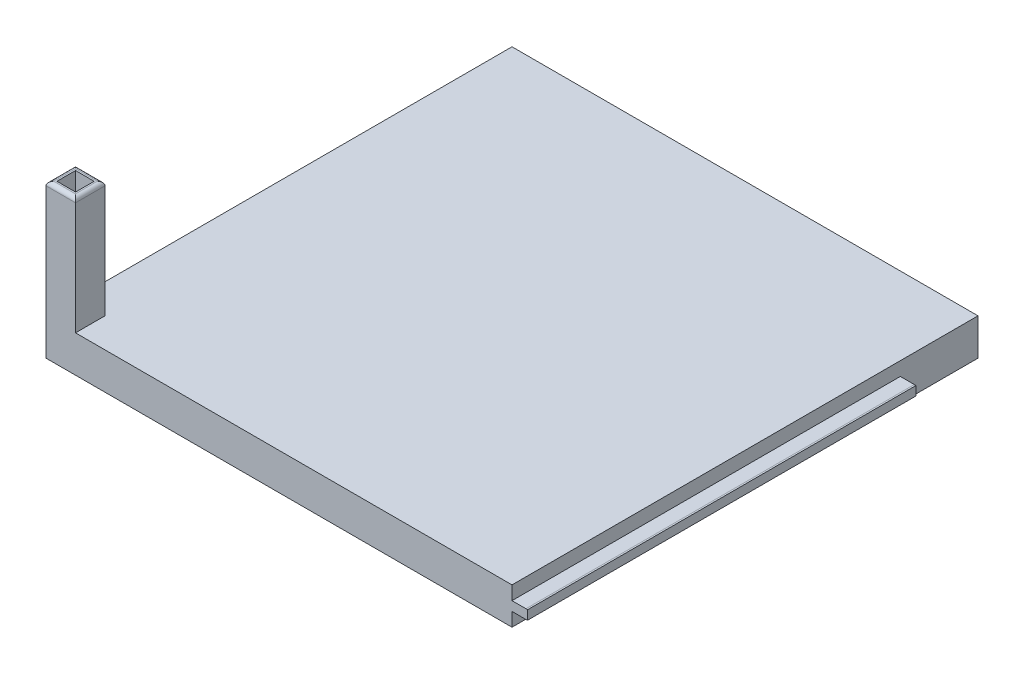
from build123d import *

# Parameters (mm, degrees)
SKETCH1_W                 = 152.4
SKETCH1_H                 = 152.4
BOSS_EXTRUDE2_DEPTH       = 12
SKETCH2_W                 = 9.652
SKETCH2_H                 = 9.652
BOSS_EXTRUDE3_DEPTH       = 38.1
SKETCH3_W                 = 5.08
SKETCH3_H                 = 3.048
BOSS_EXTRUDE4_DEPTH       = 127
CHAMFER1_SIZE             = 0.508
CHAMFER1_SIZE2            = 0.03552282
CHAMFER2_SIZE             = 0.508
CHAMFER2_SIZE2            = 0.03552282
SKETCH4_W                 = 5.334
SKETCH4_H                 = 3.175
CUT_EXTRUDE3_DEPTH        = 149.86
SKETCH5_R                 = 4.445
BOSS_EXTRUDE5_DEPTH       = 15
F_2_0MM_DOWEL_HOLE1_D     = 2
F_2_0MM_DOWEL_HOLE1_DEPTH = 4.572
F_2_0MM_DOWEL_HOLE1_TIP   = 0.600860619
SHELL1_START              = 1.778
SHELL1_OUTLINE_W          = 148.844
SHELL1_OUTLINE_H          = 143.51
SHELL1_DEPTH              = 8.444
SHELL1_START_2            = 10.222
SHELL1_2_OUTLINE_W        = 6.096
SHELL1_2_OUTLINE_H        = 6.096
SHELL1_2_DEPTH            = 39.878
SHELL1_3_OUTLINE_W        = 148.844
SHELL1_3_OUTLINE_H        = 5.334
SHELL1_3_DEPTH            = 0.8565
SHELL1_START_3            = 9.3655
SHELL1_4_OUTLINE_W        = 148.844
SHELL1_4_OUTLINE_H        = 5.334
SHELL1_4_DEPTH            = 0.8565
SHELL1_START_4            = -7.752865101
SHELL1_5_OUTLINE_R        = 2.667
SHELL1_5_DEPTH            = 9.530865101
FILLET1_R                 = 1.27


with BuildPart() as part:
    # Sketch1 → Boss-Extrude2 (new body)
    with BuildSketch(Plane(origin=(0, 0, 0), x_dir=(1, 0, 0), z_dir=(0, 1, 0))):
        with Locations((53.878787879, -60.325)):
            Rectangle(SKETCH1_W, SKETCH1_H)
    extrude(amount=BOSS_EXTRUDE2_DEPTH)

    # Sketch2 → Boss-Extrude3 (add)
    with BuildSketch(Plane(origin=(0, 12, 0), x_dir=(1, 0, 0), z_dir=(0, 1, 0))):
        with Locations((-17.495212121, -131.699)):
            Rectangle(SKETCH2_W, SKETCH2_H)
    extrude(amount=BOSS_EXTRUDE3_DEPTH)

    # Sketch3 → Boss-Extrude4 (add)
    with BuildSketch(Plane.XY.offset(136.525)):
        with Locations((132.618787879, 6)):
            Rectangle(SKETCH3_W, SKETCH3_H)
    extrude(amount=-BOSS_EXTRUDE4_DEPTH)

    # Chamfer1
    chamfer1_edges = [part.edges().sort_by_distance(p)[0] for p in [
        (135.158787879, 7.524, 73.025),
    ]]
    chamfer1_side = [part.faces().sort_by_distance(p)[0] for p in [
        (132.618787879, 7.524, 73.025),
    ]]
    chamfer(chamfer1_edges, length=CHAMFER1_SIZE, length2=CHAMFER1_SIZE2, reference=chamfer1_side[0])

    # Chamfer2
    chamfer2_edges = [part.edges().sort_by_distance(p)[0] for p in [
        (135.158787879, 4.476, 73.025),
    ]]
    chamfer2_side = [part.faces().sort_by_distance(p)[0] for p in [
        (132.618787879, 4.476, 73.025),
    ]]
    chamfer(chamfer2_edges, length=CHAMFER2_SIZE, length2=CHAMFER2_SIZE2, reference=chamfer2_side[0])

    # Sketch4 → Cut-Extrude3 (cut)
    with BuildSketch(Plane.ZY.offset(22.321212121)):
        with Locations((-13.208, 6)):
            Rectangle(SKETCH4_W, SKETCH4_H)
    extrude(amount=-CUT_EXTRUDE3_DEPTH, mode=Mode.SUBTRACT)

    # Sketch5 → Boss-Extrude5 (add)
    with BuildSketch(Plane(origin=(0, 0, 0), x_dir=(1, 0, 0), z_dir=(0, 1, 0))):
        with Locations(Location((100.106787879, -9.125, 0), (0, 0, 270))):
            Circle(SKETCH5_R)
    extrude(amount=-BOSS_EXTRUDE5_DEPTH)

    # Ø2.0mm Dowel Hole1
    with Locations(Plane(origin=(0, -15, 0), x_dir=(-1, 0, 0), z_dir=(0, -1, 0))):
        with Locations((-100.106787879, -9.125)):
            Hole(F_2_0MM_DOWEL_HOLE1_D / 2, depth=F_2_0MM_DOWEL_HOLE1_DEPTH)
            with Locations((0, 0, -(F_2_0MM_DOWEL_HOLE1_DEPTH + F_2_0MM_DOWEL_HOLE1_TIP / 2))):  # 118° drill point
                Cone(0, F_2_0MM_DOWEL_HOLE1_D / 2, F_2_0MM_DOWEL_HOLE1_TIP, mode=Mode.SUBTRACT)

    # Shell1: read off the stored shape, not the designer's step
    # Shell1 outline → Shell1 (cut)
    with BuildSketch(Plane(origin=(0, 0, 0), x_dir=(1, 0, 0), z_dir=(0, 1, 0)).offset(SHELL1_START)):
        with Locations((53.878787879, -62.992)):
            Rectangle(SHELL1_OUTLINE_W, SHELL1_OUTLINE_H)
    extrude(amount=SHELL1_DEPTH, mode=Mode.SUBTRACT)

    # Shell1 2 outline → Shell1 2 (cut)
    with BuildSketch(Plane(origin=(0, 0, 0), x_dir=(1, 0, 0), z_dir=(0, 1, 0)).offset(SHELL1_START_2)):
        with Locations((-17.495212121, -131.699)):
            Rectangle(SHELL1_2_OUTLINE_W, SHELL1_2_OUTLINE_H)
    extrude(amount=SHELL1_2_DEPTH, mode=Mode.SUBTRACT)

    # Shell1 3 outline → Shell1 3 (cut)
    with BuildSketch(Plane(origin=(0, 0, 0), x_dir=(1, 0, 0), z_dir=(0, 1, 0)).offset(SHELL1_START)):
        with Locations((53.878787879, 11.43)):
            Rectangle(SHELL1_3_OUTLINE_W, SHELL1_3_OUTLINE_H)
    extrude(amount=SHELL1_3_DEPTH, mode=Mode.SUBTRACT)

    # Shell1 4 outline → Shell1 4 (cut)
    with BuildSketch(Plane(origin=(0, 0, 0), x_dir=(1, 0, 0), z_dir=(0, 1, 0)).offset(SHELL1_START_3)):
        with Locations((53.878787879, 11.43)):
            Rectangle(SHELL1_4_OUTLINE_W, SHELL1_4_OUTLINE_H)
    extrude(amount=SHELL1_4_DEPTH, mode=Mode.SUBTRACT)

    # Shell1 5 outline → Shell1 5 (cut)
    with BuildSketch(Plane(origin=(0, 0, 0), x_dir=(1, 0, 0), z_dir=(0, 1, 0)).offset(SHELL1_START_4)):
        with Locations((100.106787879, -9.125)):
            Circle(SHELL1_5_OUTLINE_R)
    extrude(amount=SHELL1_5_DEPTH, mode=Mode.SUBTRACT)

    # Shell1 6 outline → Shell1 6 (revolve, cut)
    with BuildSketch(Plane(origin=(100.106787879, 0, 9.125), x_dir=(1, 0, 0), z_dir=(0, 0, 1))):
        Polygon((0, -7.752865201), (2.667, -9.355360472), (2.667, -7.752865101), align=None)
    revolve(axis=Axis((100.106787879, 0, 9.125), (0, 1, 0)), mode=Mode.SUBTRACT)

    # Fillet1
    fillet1_edges = [part.edges().sort_by_distance(p)[0] for p in [
        (-22.321212121, 50.1, 131.699),
        (-17.495212121, 50.1, 136.525),
        (-12.669212121, 50.1, 131.699),
        (-17.495212121, 50.1, 126.873),
    ]]
    fillet(fillet1_edges, radius=FILLET1_R)


solid = part.part
